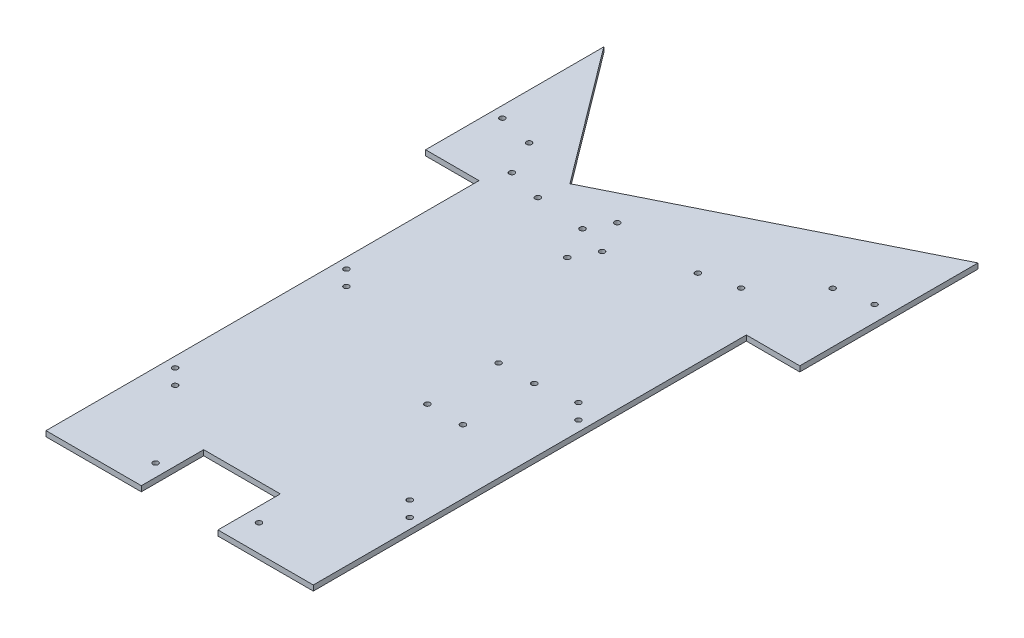
from build123d import *

# Parameters (mm, degrees)
SKETCH1_R           = 1.5
BOSS_EXTRUDE1_DEPTH = 3
SKETCH2_R           = 1.5
SKETCH2_R_2         = 1.500000005
SKETCH2_R_3         = 1.499999996
BOSS_EXTRUDE3_DEPTH = 3


with BuildPart() as part:
    # Sketch1 → Boss-Extrude1 (new body)
    with BuildSketch(Plane(origin=(0, 0, 0), x_dir=(1, 0, 0), z_dir=(0, 1, 0))):
        Polygon((-75, -100), (-75, 100), (75, 100), (75, -100), (21.5, -100), (21.5, -65), (-21.5, -65), (-21.5, -100), align=None)
        with Locations((-69.242640687, 62.79605759)):
            Circle(SKETCH1_R, mode=Mode.SUBTRACT)
        with Locations((-60.757359313, 54.310776216)):
            Circle(SKETCH1_R, mode=Mode.SUBTRACT)
        with Locations((60.757359313, 63.034810844)):
            Circle(SKETCH1_R, mode=Mode.SUBTRACT)
        with Locations((69.242640687, 54.54952947)):
            Circle(SKETCH1_R, mode=Mode.SUBTRACT)
        with Locations((-69.242640687, -33.274226936)):
            Circle(SKETCH1_R, mode=Mode.SUBTRACT)
        with Locations((-60.757359313, -41.75950831)):
            Circle(SKETCH1_R, mode=Mode.SUBTRACT)
        with Locations((60.757359313, -31.641853854)):
            Circle(SKETCH1_R, mode=Mode.SUBTRACT)
        with Locations((69.242640687, -40.127135228)):
            Circle(SKETCH1_R, mode=Mode.SUBTRACT)
        with Locations((19.1, 59.87604307)):
            Circle(SKETCH1_R, mode=Mode.SUBTRACT)
        with Locations((39.1, 19.87604307)):
            Circle(SKETCH1_R, mode=Mode.SUBTRACT)
        with Locations((19.1, 19.87604307)):
            Circle(SKETCH1_R, mode=Mode.SUBTRACT)
        with Locations((39.1, 59.87604307)):
            Circle(SKETCH1_R, mode=Mode.SUBTRACT)
        with Locations((-28.5, -85)):
            Circle(SKETCH1_R, mode=Mode.SUBTRACT)
        with Locations((29.5, -85)):
            Circle(SKETCH1_R, mode=Mode.SUBTRACT)
    extrude(amount=BOSS_EXTRUDE1_DEPTH)

    # Sketch2 → Boss-Extrude3 (add)
    with BuildSketch(Plane(origin=(0, 3, 0), x_dir=(1, 0, 0), z_dir=(0, 1, 0))):
        Polygon((-75, 100), (-75, 143), (-105, 143), (-105, 243), (-48, 167), (105, 243), (105, 143), (75, 143), (75, 100), align=None)
        with Locations((-12.871401164, 130.377195869)):
            Circle(SKETCH2_R, mode=Mode.SUBTRACT)
        with Locations((-6.031802552, 143.074435365)):
            Circle(SKETCH2_R, mode=Mode.SUBTRACT)
        with Locations((-15.737183302, 161.327601796)):
            Circle(SKETCH2_R, mode=Mode.SUBTRACT)
        with Locations((-22.576781914, 148.6303623)):
            Circle(SKETCH2_R, mode=Mode.SUBTRACT)
        with Locations((31.340042846, 159.444468602)):
            Circle(SKETCH2_R_2, mode=Mode.SUBTRACT)
        with Locations((50.742574776, 164.296453218)):
            Circle(SKETCH2_R_2, mode=Mode.SUBTRACT)
        with Locations((76.536595954, 189.88324741)):
            Circle(SKETCH2_R_2, mode=Mode.SUBTRACT)
        with Locations((96.155699061, 193.767934434)):
            Circle(SKETCH2_R_2, mode=Mode.SUBTRACT)
        with Locations((-50.270108513, 151.236438257)):
            Circle(SKETCH2_R_3, mode=Mode.SUBTRACT)
        with Locations((-69.672640442, 156.088422873)):
            Circle(SKETCH2_R_3, mode=Mode.SUBTRACT)
        with Locations((-79.321204368, 175.416451105)):
            Circle(SKETCH2_R_3, mode=Mode.SUBTRACT)
        with Locations((-98.81252438, 179.898464515)):
            Circle(SKETCH2_R_3, mode=Mode.SUBTRACT)
    extrude(amount=-BOSS_EXTRUDE3_DEPTH)


solid = part.part
